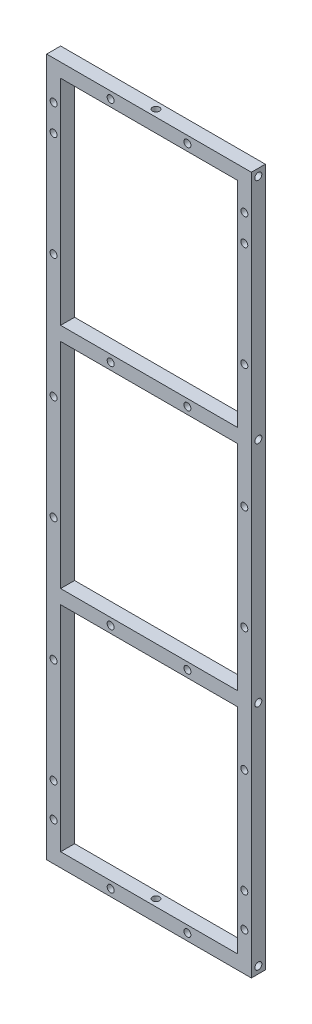
from build123d import *

# Parameters (mm, degrees)
SKETCH1_W           = 88
SKETCH1_H           = 300
SKETCH1_W_2         = 76
SKETCH1_H_2         = 92
BOSS_EXTRUDE1_DEPTH = 6
SKETCH2_R           = 1.5
CUT_EXTRUDE1_DEPTH  = 10
SKETCH3_R           = 1.5
CUT_EXTRUDE2_DEPTH  = 10
SKETCH4_R           = 1.5
CUT_EXTRUDE3_DEPTH  = 10
SKETCH5_R           = 1.5
CUT_EXTRUDE4_DEPTH  = 10


with BuildPart() as part:
    # Sketch1 → Boss-Extrude1 (new body)
    with BuildSketch(Plane.XY):
        Rectangle(SKETCH1_W, SKETCH1_H)
        with Locations((0, 98)):
            Rectangle(SKETCH1_W_2, SKETCH1_H_2, mode=Mode.SUBTRACT)
        with Locations((0, -98)):
            Rectangle(SKETCH1_W_2, SKETCH1_H_2, mode=Mode.SUBTRACT)
        Rectangle(SKETCH1_W_2, SKETCH1_H_2, mode=Mode.SUBTRACT)
    extrude(amount=BOSS_EXTRUDE1_DEPTH)

    # Sketch2 → Cut-Extrude1 (cut)
    with BuildSketch(Plane(origin=(44, 0, 0), x_dir=(0, 0, -1), z_dir=(1, 0, 0))):
        with Locations((-3, 147)):
            Circle(SKETCH2_R)
        with Locations((-3, 49)):
            Circle(SKETCH2_R)
        with Locations((-3, -49)):
            Circle(SKETCH2_R)
        with Locations((-3, -147)):
            Circle(SKETCH2_R)
    cut_extrude1 = extrude(amount=-CUT_EXTRUDE1_DEPTH, mode=Mode.SUBTRACT)

    # Mirror1: Cut-Extrude1 across plane
    add(cut_extrude1.mirror(Plane(origin=(0, 0, 0), x_dir=(0, 0, 1), z_dir=(1, 0, 0))), mode=Mode.SUBTRACT)

    # Sketch3 → Cut-Extrude2 (cut)
    with BuildSketch(Plane.XY.offset(6)):
        with Locations((-41, 133.5)):
            Circle(SKETCH3_R)
        with Locations((41, 133.5)):
            Circle(SKETCH3_R)
    cut_extrude2 = extrude(amount=-CUT_EXTRUDE2_DEPTH, mode=Mode.SUBTRACT)

    # Sketch4 → Cut-Extrude3 (cut)
    with BuildSketch(Plane.XY.offset(6)):
        with Locations((-16.5, 147)):
            Circle(SKETCH4_R)
        with Locations((16.5, 147)):
            Circle(SKETCH4_R)
        with Locations((16.5, 49)):
            Circle(SKETCH4_R)
        with Locations((-16.5, 49)):
            Circle(SKETCH4_R)
        with Locations((16.5, -49)):
            Circle(SKETCH4_R)
        with Locations((-16.5, -49)):
            Circle(SKETCH4_R)
        with Locations((16.5, -147)):
            Circle(SKETCH4_R)
        with Locations((-16.5, -147)):
            Circle(SKETCH4_R)
        with Locations((-41.040928423, 122)):
            Circle(SKETCH4_R)
        with Locations((-41.040928423, 77)):
            Circle(SKETCH4_R)
        with Locations((40.959071577, 122)):
            Circle(SKETCH4_R)
        with Locations((40.959071577, 77)):
            Circle(SKETCH4_R)
        with Locations((40.959071577, 24)):
            Circle(SKETCH4_R)
        with Locations((40.959071577, -21)):
            Circle(SKETCH4_R)
        with Locations((40.959071577, -74)):
            Circle(SKETCH4_R)
        with Locations((40.959071577, -119)):
            Circle(SKETCH4_R)
        with Locations((-41.040928423, 24)):
            Circle(SKETCH4_R)
        with Locations((-41.040928423, -21)):
            Circle(SKETCH4_R)
        with Locations((-41.040928423, -74)):
            Circle(SKETCH4_R)
        with Locations((-41.040928423, -119)):
            Circle(SKETCH4_R)
    extrude(amount=-CUT_EXTRUDE3_DEPTH, mode=Mode.SUBTRACT)

    # Sketch5 → Cut-Extrude4 (cut)
    with BuildSketch(Plane(origin=(0, 150, 0), x_dir=(1, 0, 0), z_dir=(0, 1, 0))):
        with Locations((0, -3)):
            Circle(SKETCH5_R)
    cut_extrude4 = extrude(amount=-CUT_EXTRUDE4_DEPTH, mode=Mode.SUBTRACT)

    # Mirror2: Cut-Extrude4 across plane
    add(cut_extrude4.mirror(Plane.ZX), mode=Mode.SUBTRACT)

    # Mirror3: Cut-Extrude2 across plane
    add(cut_extrude2.mirror(Plane.ZX), mode=Mode.SUBTRACT)


solid = part.part
